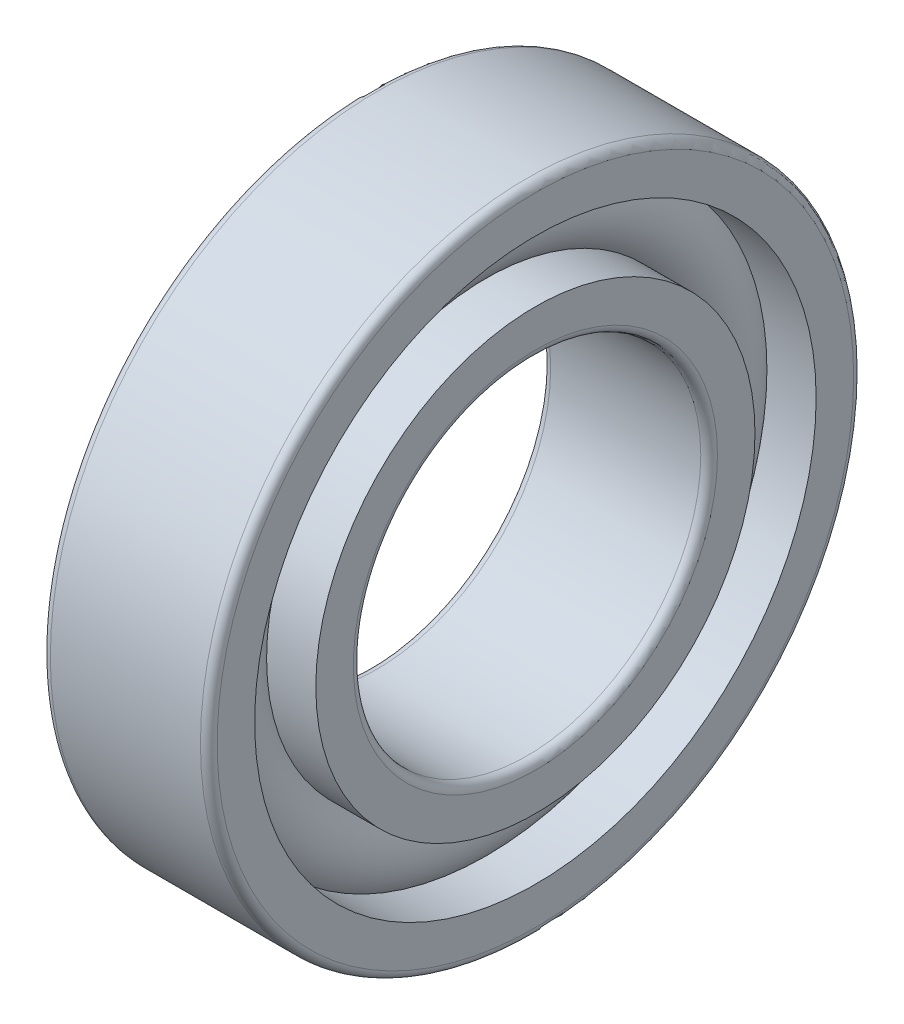
from build123d import *

# Parameters (mm, degrees)
CAGSPISKE_W     = 0.66
CAGSPISKE_H     = 1.1
CAGESPINE_ANGLE = 0.001
BALSIMSKE_R     = 3.3


with BuildPart() as part:
    # CagSpiSke → CageSpine (revolve)
    with BuildSketch(Plane.XY):
        with Locations((0, 18)):
            Rectangle(CAGSPISKE_W, CAGSPISKE_H)
    revolve(axis=Axis((-20.6375, 0, 0), (-1, 0, 0)), revolution_arc=CAGESPINE_ANGLE)

    # BalSimSke → BallsSimplified (revolve)
    with BuildSketch(Plane.XY):
        with Locations((0, 18)):
            Circle(BALSIMSKE_R)
    revolve(axis=Axis((-10, 0, 0), (1, 0, 0)))

    # InnRacSke → InnerRace (revolve)
    with BuildSketch(Plane.XY):
        with BuildLine():
            Line((-2.426030709, 15.8), (-6, 15.8))
            Line((-6, 15.8), (-6, 13.1))
            ThreePointArc((-6, 13.1), (-5.824264069, 12.675735931), (-5.4, 12.5))
            Line((-5.4, 12.5), (5.4, 12.5))
            ThreePointArc((5.4, 12.5), (5.824264069, 12.675735931), (6, 13.1))
            Line((6, 13.1), (6, 15.8))
            Line((6, 15.8), (2.426030709, 15.8))
            ThreePointArc((2.426030709, 15.8), (0, 14.725), (-2.426030709, 15.8))
        make_face()
    revolve(axis=Axis((-20.6375, 0, 0), (1, 0, 0)))

    # OutRacSke → OuterRace (revolve)
    with BuildSketch(Plane.XY):
        with BuildLine():
            Line((-2.426030709, 20.2), (-6, 20.2))
            Line((-6, 20.2), (-6, 22.9))
            ThreePointArc((-6, 22.9), (-5.824264069, 23.324264069), (-5.4, 23.5))
            Line((-5.4, 23.5), (5.4, 23.5))
            ThreePointArc((5.4, 23.5), (5.824264069, 23.324264069), (6, 22.9))
            Line((6, 22.9), (6, 20.2))
            Line((6, 20.2), (2.426030709, 20.2))
            ThreePointArc((2.426030709, 20.2), (0, 21.275), (-2.426030709, 20.2))
        make_face()
    revolve(axis=Axis((-20.6375, 0, 0), (1, 0, 0)))


solid = part.part
